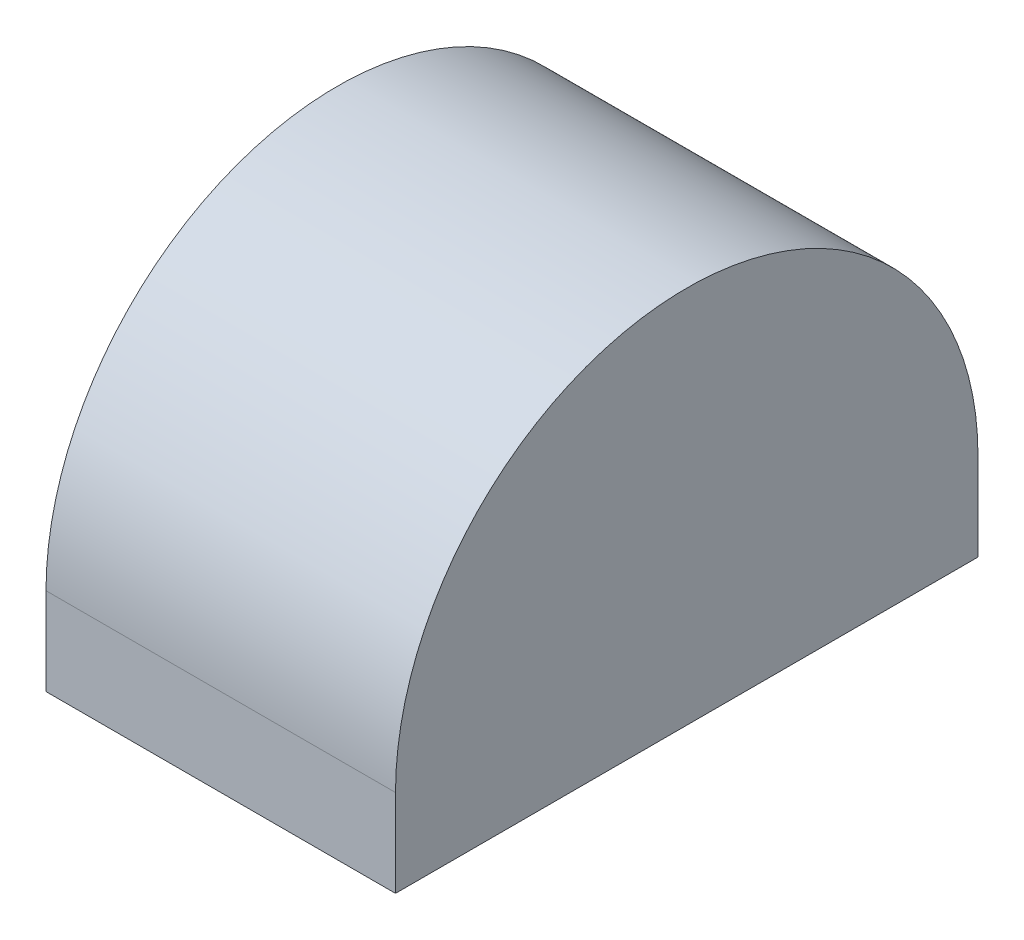
from build123d import *

# Parameters (mm, degrees)
BOSS_EXTRUDE1_DEPTH = 6
CUT_EXTRUDE1_DEPTH  = 3.5


with BuildPart() as part:
    # Sketch1 → Boss-Extrude1 (new, symmetric)
    with BuildSketch(Plane(origin=(0, 0, 0), x_dir=(0, 0, -1), z_dir=(1, 0, 0))):
        with BuildLine():
            Line((0, 0), (0, 3))
            ThreePointArc((0, 3), (10, 13), (20, 3))
            Line((20, 3), (20, 0))
            Line((20, 0), (0, 0))
        make_face()
    extrude(amount=BOSS_EXTRUDE1_DEPTH, both=True)

    # Sketch2 → Cut-Extrude1 (cut, symmetric)
    with BuildSketch(Plane(origin=(0, 0, 0), x_dir=(0, 0, -1), z_dir=(1, 0, 0))):
        with BuildLine():
            Line((10, 0), (17.5, 0))
            Line((17.5, 0), (17.5, 3))
            ThreePointArc((17.5, 3), (16.532377607, 6.611215932), (13.888784068, 9.254809472))
            Line((13.888784068, 9.254809472), (10, 11.5))
            Line((10, 11.5), (6.111215932, 9.254809472))
            ThreePointArc((6.111215932, 9.254809472), (3.467622393, 6.611215932), (2.5, 3))
            Line((2.5, 3), (2.5, 0))
            Line((2.5, 0), (10, 0))
        make_face()
    extrude(amount=CUT_EXTRUDE1_DEPTH, both=True, mode=Mode.SUBTRACT)


solid = part.part
